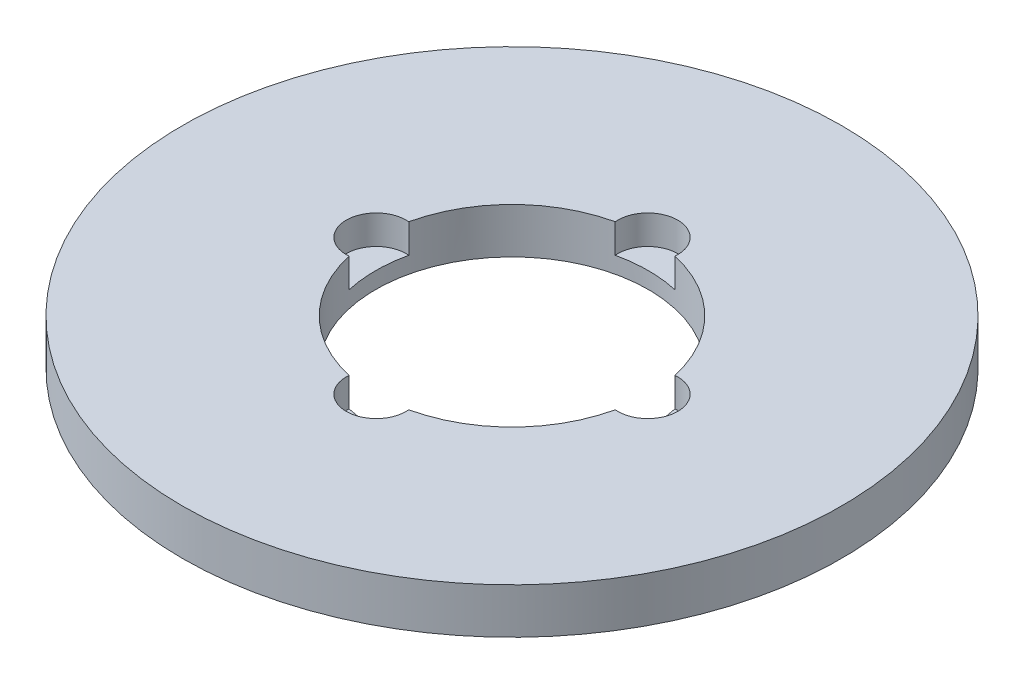
from build123d import *

# Parameters (mm, degrees)
SKETCH1_R           = 72.5
BOSS_EXTRUDE1_DEPTH = 10
SKETCH2_R           = 30
CUT_EXTRUDE1_DEPTH  = 104.01698889
SKETCH3_R           = 6.587498209
CUT_EXTRUDE2_DEPTH  = 6.394431975
CIRPATTERN1_COUNT   = 4


with BuildPart() as part:
    # Sketch1 → Boss-Extrude1 (new body)
    with BuildSketch(Plane(origin=(0, 0, 0), x_dir=(1, 0, 0), z_dir=(0, 1, 0))):
        Circle(SKETCH1_R)
    extrude(amount=BOSS_EXTRUDE1_DEPTH)

    # Sketch2 → Cut-Extrude1 (cut, through all)
    with BuildSketch(Plane(origin=(0, 0, 0), x_dir=(1, 0, 0), z_dir=(0, 1, 0))):
        Circle(SKETCH2_R)
    extrude(amount=CUT_EXTRUDE1_DEPTH, mode=Mode.SUBTRACT)

    # Sketch3 → Cut-Extrude2 (cut)
    with BuildSketch(Plane(origin=(0, 10, 0), x_dir=(1, 0, 0), z_dir=(0, 1, 0))):
        with Locations((-29.872414045, 0)):
            Circle(SKETCH3_R)
    cut_extrude2 = extrude(amount=-CUT_EXTRUDE2_DEPTH, mode=Mode.SUBTRACT)

    # CirPattern1: Cut-Extrude2 ×4 about axis
    cirpattern1_axis = Axis((0, 0, 0), (0, 1, 0))
    for i in range(1, CIRPATTERN1_COUNT):
        add(cut_extrude2.rotate(cirpattern1_axis, i * 360 / CIRPATTERN1_COUNT), mode=Mode.SUBTRACT)


solid = part.part
